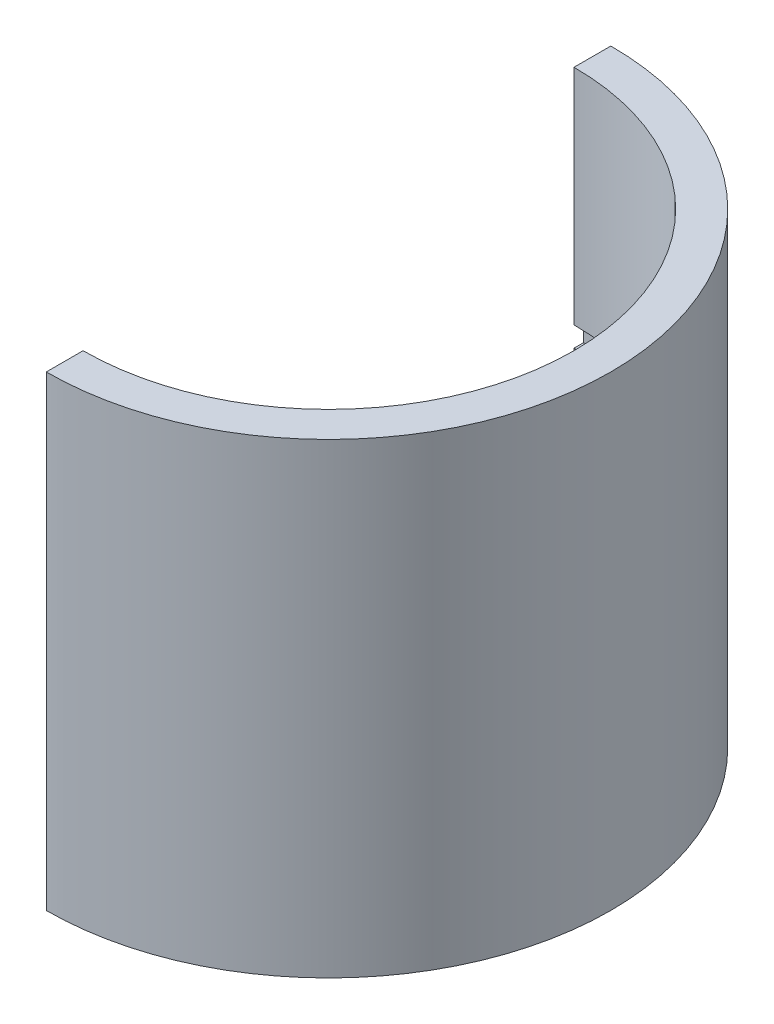
from build123d import *

# Parameters (mm, degrees)
BOSS_EXTRUDE1_DEPTH       = 19
CUT_REVOLVE_THIN4_START   = 9.090052714
CUT_REVOLVE_THIN4_DEPTH   = 0.819894572
CUT_REVOLVE_THIN4_START_2 = 9.100052714
CUT_REVOLVE_THIN4_2_DEPTH = 0.799894572


with BuildPart() as part:
    # Sketch1 → Boss-Extrude1 (new body)
    with BuildSketch(Plane(origin=(0, 0, 0), x_dir=(1, 0, 0), z_dir=(0, 1, 0))):
        with BuildLine():
            Line((0, -10), (0, -11.5))
            ThreePointArc((0, -11.5), (8.131727984, -8.131727984), (11.5, 0))
            ThreePointArc((11.5, 0), (8.131727984, 8.131727984), (0, 11.5))
            Line((0, 11.5), (0, 10))
            ThreePointArc((0, 10), (7.071067812, 7.071067812), (10, 0))
            ThreePointArc((10, 0), (7.071067812, -7.071067812), (0, -10))
        make_face()
    extrude(amount=BOSS_EXTRUDE1_DEPTH)

    # Cut-Revolve-Thin4: read off the stored shape, not the designer's step
    # Cut-Revolve-Thin4 outline → Cut-Revolve-Thin4 (cut)
    with BuildSketch(Plane(origin=(0, 0, 0), x_dir=(1, 0, 0), z_dir=(0, 1, 0)).offset(CUT_REVOLVE_THIN4_START)):
        with BuildLine():
            ThreePointArc((0, -10.385), (10.385, 0), (0, 10.385))
            Line((0, 10.385), (0, 10))
            ThreePointArc((0, 10), (10, 0), (0, -10))
            Line((0, -10), (0, -10.385))
        make_face()
    extrude(amount=CUT_REVOLVE_THIN4_DEPTH, mode=Mode.SUBTRACT)


with BuildPart() as body_2:
    # Cut-Revolve-Thin4 2 outline → Cut-Revolve-Thin4 2 (new body)
    with BuildSketch(Plane(origin=(0, 0, 0), x_dir=(1, 0, 0), z_dir=(0, 1, 0)).offset(CUT_REVOLVE_THIN4_START_2)):
        with BuildLine():
            Line((0, 10.375), (0, 10))
            ThreePointArc((0, 10), (10, 0), (0, -10))
            Line((0, -10), (0, -10.375))
            ThreePointArc((0, -10.375), (10.375, 0), (0, 10.375))
        make_face()
    extrude(amount=CUT_REVOLVE_THIN4_2_DEPTH)


solid = part.part
